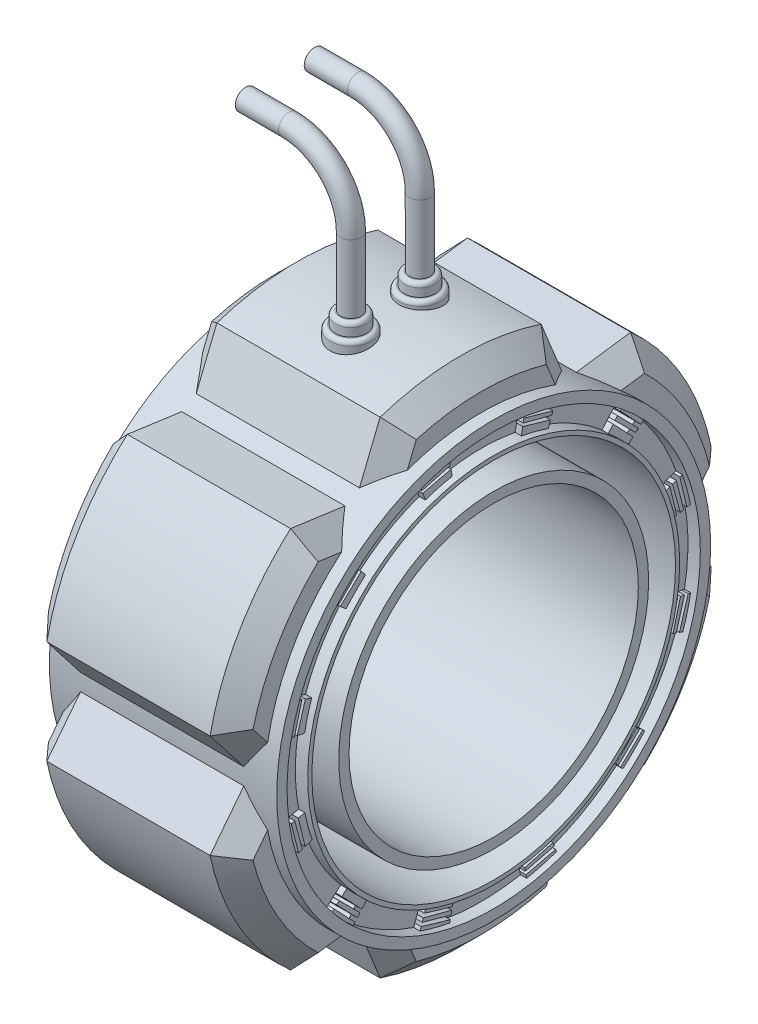
from build123d import *

# Parameters (mm, degrees)
SKETCH6_R                    = 105
SKETCH6_R_2                  = 100
EXTRUDE_THIN1_DEPTH          = 110
SKETCH6_5_R                  = 75
SKETCH6_5_R_2                = 70
EXTRUDE_THIN2_DEPTH          = 110
SKETCH6_6_R                  = 90
SKETCH6_6_R_2                = 88
EXTRUDE_THIN3_DEPTH          = 110
BOSS_EXTRUDE1_START          = -52
BOSS_EXTRUDE1_DEPTH          = 96
CIRPATTERN1_COUNT            = 12
BOSS_EXTRUDE2_START          = -55
BOSS_EXTRUDE2_DEPTH          = 102
CIRPATTERN2_COUNT            = 12
BOSS_EXTRUDE3_START          = -55
BOSS_EXTRUDE3_DEPTH          = 99
CHAMFER1_SIZE                = 10
CIRPATTERN3_COUNT            = 6
CHAMFER1_OF_CIRPATTERN3_SIZE = 10
SWEEP1_PROFILE_R             = 5
BOSS_EXTRUDE4_START          = -1
SKETCH21_R                   = 10
BOSS_EXTRUDE4_DEPTH          = 8
SKETCH21_3_R                 = 7.5
BOSS_EXTRUDE5_DEPTH          = 13
FILLET1_R                    = 2
FILLET1_OF_MIRROR2_R         = 2


with BuildPart() as part:
    # Sketch6 → Extrude-Thin1 (new body)
    with BuildSketch(Plane(origin=(0, 0, 0), x_dir=(0, 0, -1), z_dir=(1, 0, 0))):
        Circle(SKETCH6_R)
        Circle(SKETCH6_R_2, mode=Mode.SUBTRACT)
    extrude(amount=EXTRUDE_THIN1_DEPTH)



with BuildPart() as body_2:
    # Sketch6<5> → Extrude-Thin2 (new body)
    with BuildSketch(Plane(origin=(0, 0, 0), x_dir=(0, 0, -1), z_dir=(1, 0, 0))):
        Circle(SKETCH6_5_R)
        Circle(SKETCH6_5_R_2, mode=Mode.SUBTRACT)
    extrude(amount=EXTRUDE_THIN2_DEPTH)


with BuildPart() as body_3:
    # Sketch6<6> → Extrude-Thin3 (new body)
    with BuildSketch(Plane(origin=(0, 0, 0), x_dir=(0, 0, -1), z_dir=(1, 0, 0))):
        Circle(SKETCH6_6_R)
        Circle(SKETCH6_6_R_2, mode=Mode.SUBTRACT)
    extrude(amount=EXTRUDE_THIN3_DEPTH)


with BuildPart() as part_1:
    add(part.part)

    add(body_3.part)  # Boss-Extrude1 merges body 3
    # Sketch8 → Boss-Extrude1 (add)
    with BuildSketch(Plane(origin=(60, 0, 0), x_dir=(0, 0, -1), z_dir=(1, 0, 0)).offset(BOSS_EXTRUDE1_START)):
        with BuildLine():
            Line((-18.945180891, 98.189002037), (-17.050662802, 88.370101833))
            ThreePointArc((-17.050662802, 88.370101833), (-0.333832157, 89.999380865), (16.394625202, 88.494159494))
            Line((16.394625202, 88.494159494), (18.216250224, 98.326843882))
            ThreePointArc((18.216250224, 98.326843882), (-0.370924619, 99.999312072), (-18.945180891, 98.189002037))
        make_face()
    boss_extrude1 = extrude(amount=BOSS_EXTRUDE1_DEPTH)

    # CirPattern1: Boss-Extrude1 ×12 about axis
    cirpattern1_axis = Axis((0, 0, 0), (1, 0, 0))
    for i in range(1, CIRPATTERN1_COUNT):
        add(boss_extrude1.rotate(cirpattern1_axis, i * 360 / CIRPATTERN1_COUNT))

    # Sketch9 → Boss-Extrude2 (add)
    with BuildSketch(Plane(origin=(60, 0, 0), x_dir=(0, 0, -1), z_dir=(1, 0, 0)).offset(BOSS_EXTRUDE2_START)):
        with BuildLine():
            ThreePointArc((32.687493088, 94.506760582), (25.523440793, 96.687920497), (18.216250224, 98.326843882))
            Line((18.216250224, 98.326843882), (17.988276723, 97.096298926))
            Line((17.988276723, 97.096298926), (32.129794034, 92.894329467))
            Line((32.129794034, 92.894329467), (32.687493088, 94.506760582))
        make_face()
        Polygon((31.6035361, 91.372801571), (17.661727911, 95.333668653), (17.305437713, 93.410501688), (31.053118433, 89.781422553), align=None)
        with BuildLine():
            Line((30.483362327, 88.134131836), (17.061300107, 92.092706865))
            Line((17.061300107, 92.092706865), (16.394625202, 88.494159494))
            ThreePointArc((16.394625202, 88.494159494), (22.971096713, 87.019128448), (29.418743779, 85.056084524))
            Line((29.418743779, 85.056084524), (30.483362327, 88.134131836))
        make_face()
    boss_extrude2 = extrude(amount=BOSS_EXTRUDE2_DEPTH)

    # CirPattern2: Boss-Extrude2 ×12 about axis
    cirpattern2_axis = Axis((110, 0, 0), (1, 0, 0))
    for i in range(1, CIRPATTERN2_COUNT):
        add(boss_extrude2.rotate(cirpattern2_axis, i * 360 / CIRPATTERN2_COUNT))

    # Sketch10 → Boss-Extrude3 (add)
    with BuildSketch(Plane(origin=(60, 0, 0), x_dir=(0, 0, -1), z_dir=(1, 0, 0)).offset(BOSS_EXTRUDE3_START)):
        with BuildLine():
            Line((-38.959771343, 117.519633967), (-48.957315286, 92.888003962))
            ThreePointArc((-48.957315286, 92.888003962), (0, 105), (48.957315286, 92.888003962))
            Line((48.957315286, 92.888003962), (38.959771343, 117.519633967))
            ThreePointArc((38.959771343, 117.519633967), (0, 123.809240975), (-38.959771343, 117.519633967))
        make_face()
    boss_extrude3 = extrude(amount=BOSS_EXTRUDE3_DEPTH)

    # Chamfer1
    chamfer1_edges = [part_1.edges().sort_by_distance(p)[0] for p in [
        (5, 105.203818964, 43.958543314),
        (5, 123.809240975, 0),
        (5, 105.203818964, -43.958543314),
        (104, 105.203818964, -43.958543314),
        (104, 123.809240975, 0),
        (104, 105.203818964, 43.958543314),
    ]]
    chamfer(chamfer1_edges, length=CHAMFER1_SIZE)

    # CirPattern3: Boss-Extrude3 ×6 about axis
    cirpattern3_axis = Axis((110, 0, 0), (1, 0, 0))
    for i in range(1, CIRPATTERN3_COUNT):
        add(boss_extrude3.rotate(cirpattern3_axis, i * 360 / CIRPATTERN3_COUNT))

    # Chamfer1 of CirPattern3
    chamfer1_of_cirpattern3_edges = [part_1.edges().sort_by_distance(p)[0] for p in [
        (5, 14.532694259, 113.088451455),
        (5, 61.904620488, 107.221947908),
        (5, 90.671124706, 69.129908141),
        (104, 90.671124706, 69.129908141),
        (104, 61.904620488, 107.221947908),
        (104, 14.532694259, 113.088451455),
        (5, -90.671124706, 69.129908141),
        (5, -61.904620488, 107.221947908),
        (5, -14.532694259, 113.088451455),
        (104, -14.532694259, 113.088451455),
        (104, -61.904620488, 107.221947908),
        (104, -90.671124706, 69.129908141),
        (5, -105.203818964, -43.958543314),
        (5, -123.809240975, 0),
        (5, -105.203818964, 43.958543314),
        (104, -105.203818964, 43.958543314),
        (104, -123.809240975, 0),
        (104, -105.203818964, -43.958543314),
        (5, -14.532694259, -113.088451455),
        (5, -61.904620488, -107.221947908),
        (5, -90.671124706, -69.129908141),
        (104, -90.671124706, -69.129908141),
        (104, -61.904620488, -107.221947908),
        (104, -14.532694259, -113.088451455),
        (5, 90.671124706, -69.129908141),
        (5, 61.904620488, -107.221947908),
        (5, 14.532694259, -113.088451455),
        (104, 14.532694259, -113.088451455),
        (104, 61.904620488, -107.221947908),
        (104, 90.671124706, -69.129908141),
    ]]
    chamfer(chamfer1_of_cirpattern3_edges, length=CHAMFER1_OF_CIRPATTERN3_SIZE)

    # Sweep1: sweep along a curve in space
    with BuildLine() as sweep1_path:
        Line((57.593552458, 102.017051511, 16.674423595), (57.593552458, 166.003070724, 16.674423595))
        ThreePointArc((27.593552458, 196.003070724, 16.674423595), (48.806755893, 187.21627416, 16.674423595), (57.593552458, 166.003070724, 16.674423595))
        Line((27.593552458, 196.003070724, 16.674423595), (6.638683644, 196.003070724, 16.674423595))
    # Sweep1 profile (on start of the path) → Sweep1 (sweep)
    with BuildSketch(Plane(origin=(57.593552458, 102.017051511, 16.674423595), x_dir=(0, 0, 1), z_dir=(0, 1, 0))):
        Circle(SWEEP1_PROFILE_R)
    sweep1 = sweep(path=sweep1_path.line)

    # Mirror1: Sweep1 across plane
    add(sweep1.mirror(Plane.XY))

    # Sketch21 → Boss-Extrude4 (add)
    with BuildSketch(Plane(origin=(0, 120, 0), x_dir=(1, 0, 0), z_dir=(0, 1, 0)).offset(BOSS_EXTRUDE4_START)):
        with Locations((57.593552458, 16.674423595)):
            Circle(SKETCH21_R)
    boss_extrude4 = extrude(amount=BOSS_EXTRUDE4_DEPTH)

    # Sketch21<3> → Boss-Extrude5 (add)
    with BuildSketch(Plane(origin=(0, 120, 0), x_dir=(1, 0, 0), z_dir=(0, 1, 0))):
        with Locations((57.593552458, 16.674423595)):
            Circle(SKETCH21_3_R)
    boss_extrude5 = extrude(amount=BOSS_EXTRUDE5_DEPTH)

    # Fillet1
    fillet1_edges = [part_1.edges().sort_by_distance(p)[0] for p in [
        (47.593552458, 127, -16.674423595),
        (50.093552458, 133, -16.674423595),
    ]]
    fillet(fillet1_edges, radius=FILLET1_R)

    # Mirror2: Boss-Extrude4, Boss-Extrude5 across plane
    add(boss_extrude4.mirror(Plane.XY))
    add(boss_extrude5.mirror(Plane.XY))

    # Fillet1 of Mirror2
    fillet1_of_mirror2_edges = [part_1.edges().sort_by_distance(p)[0] for p in [
        (47.593552458, 127, 16.674423595),
        (50.093552458, 133, 16.674423595),
    ]]
    fillet(fillet1_of_mirror2_edges, radius=FILLET1_OF_MIRROR2_R)


solid = Compound([body_2.part, part_1.part])
